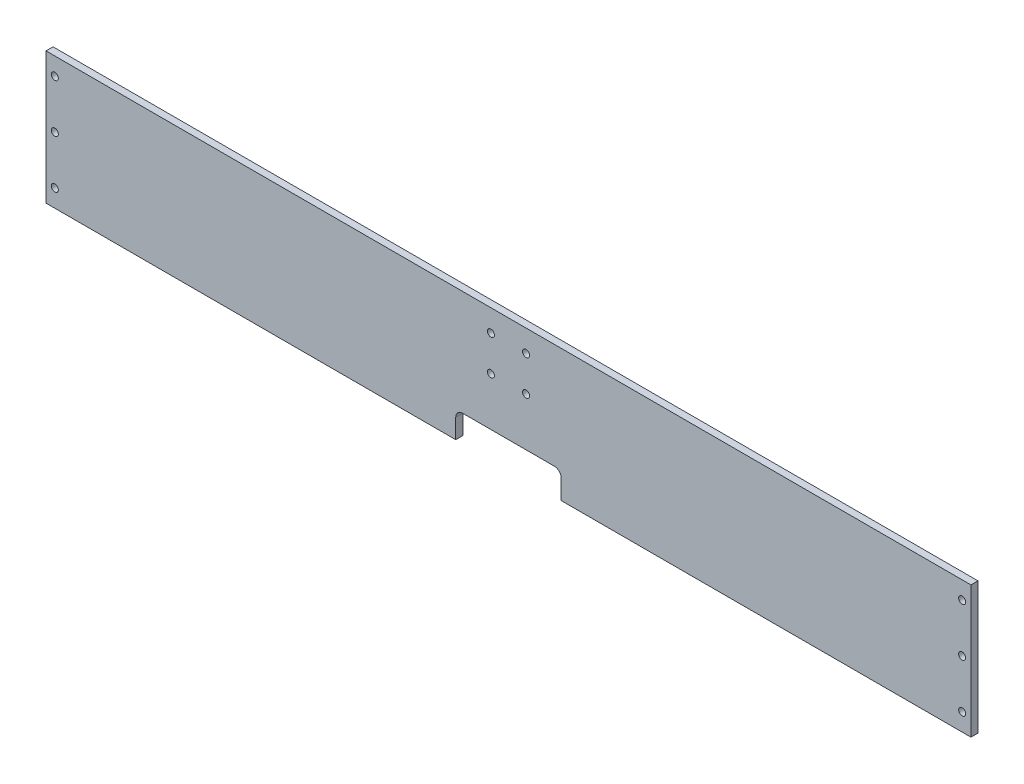
from build123d import *

# Parameters (mm, degrees)
SCHIZZO1_W                   = 526
SCHIZZO1_H                   = 75
SCHIZZO1_R                   = 2
ESTRUSIONE_ESTRUSIONE1_DEPTH = 4
SCHIZZO2_R                   = 2
TAGLIO_ESTRUSIONE1_DEPTH     = 4


with BuildPart() as part:
    # Schizzo1 → Estrusione-Estrusione1 (new body)
    with BuildSketch(Plane.XY):
        with Locations((263, 37.5)):
            Rectangle(SCHIZZO1_W, SCHIZZO1_H)
        with Locations((5, 37.5)):
            Circle(SCHIZZO1_R, mode=Mode.SUBTRACT)
        with Locations((5, 65)):
            Circle(SCHIZZO1_R, mode=Mode.SUBTRACT)
        with Locations((5, 10)):
            Circle(SCHIZZO1_R, mode=Mode.SUBTRACT)
        with Locations((521, 10)):
            Circle(SCHIZZO1_R, mode=Mode.SUBTRACT)
        with Locations((521, 65)):
            Circle(SCHIZZO1_R, mode=Mode.SUBTRACT)
        with Locations((521, 37.5)):
            Circle(SCHIZZO1_R, mode=Mode.SUBTRACT)
    extrude(amount=-ESTRUSIONE_ESTRUSIONE1_DEPTH)

    # Schizzo2 → Taglio-Estrusione1 (cut)
    with BuildSketch(Plane.XY):
        with Locations((253, 62.5)):
            Circle(SCHIZZO2_R)
        with Locations((273, 62.5)):
            Circle(SCHIZZO2_R)
        with Locations((253, 42.5)):
            Circle(SCHIZZO2_R)
        with Locations((273, 42.5)):
            Circle(SCHIZZO2_R)
        with BuildLine():
            Line((293, -15), (293, 11))
            ThreePointArc((293, 11), (291.828427125, 13.828427125), (289, 15))
            Line((289, 15), (237, 15))
            ThreePointArc((237, 15), (234.171572875, 13.828427125), (233, 11))
            Line((233, 11), (233, -15))
            Line((233, -15), (293, -15))
        make_face()
    extrude(amount=-TAGLIO_ESTRUSIONE1_DEPTH, mode=Mode.SUBTRACT)


solid = part.part
